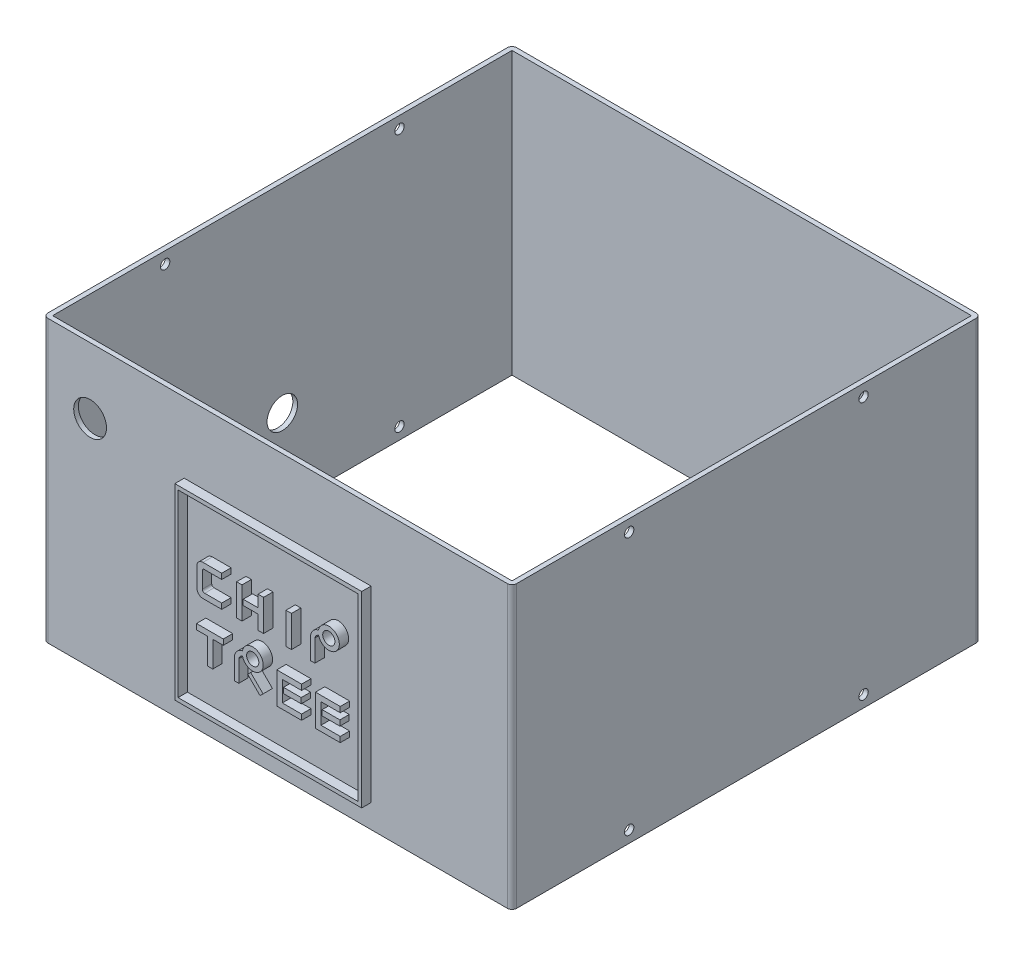
from build123d import *

# Parameters (mm, degrees)
SKETCH1_W                 = 100
SKETCH1_H                 = 100
BOSS_EXTRUDE1_DEPTH       = 60
SKETCH2_W                 = 98
SKETCH2_H                 = 98
CUT_EXTRUDE1_DEPTH        = 60
SKETCH3_R                 = 1
CUT_EXTRUDE2_DEPTH        = 125
CUT_EXTRUDE3_DEPTH        = 10
BOSS_EXTRUDE4_START       = 50
BOSS_EXTRUDE4_OUTLINE_W   = 39.858082606
BOSS_EXTRUDE4_OUTLINE_H   = 40
BOSS_EXTRUDE4_OUTLINE_W_2 = 38.374033315
BOSS_EXTRUDE4_OUTLINE_H_2 = 38.356376399
BOSS_EXTRUDE4_OUTLINE_W_3 = 1.151682465
BOSS_EXTRUDE4_OUTLINE_H_3 = 6.68708673
BOSS_EXTRUDE4_OUTLINE_W_4 = 1.169732075
BOSS_EXTRUDE4_OUTLINE_R   = 1.29952059
BOSS_EXTRUDE4_OUTLINE_W_5 = 3.781559684
BOSS_EXTRUDE4_OUTLINE_H_4 = 1.155970525
BOSS_EXTRUDE4_OUTLINE_W_6 = 3.781559683
BOSS_EXTRUDE4_DEPTH       = 2
SKETCH9_R                 = 3.5
CUT_EXTRUDE4_DEPTH        = 10
FILLET1_R                 = 1


# Read off the part's stored shape, not the designer's step: Boss-Extrude4
with BuildPart() as part:
    # Sketch1 → Boss-Extrude1 (new body)
    with BuildSketch(Plane(origin=(0, 0, 0), x_dir=(1, 0, 0), z_dir=(0, 1, 0))):
        Rectangle(SKETCH1_W, SKETCH1_H)
    extrude(amount=BOSS_EXTRUDE1_DEPTH)

    # Sketch2 → Cut-Extrude1 (cut)
    with BuildSketch(Plane(origin=(0, 60, 0), x_dir=(1, 0, 0), z_dir=(0, 1, 0))):
        Rectangle(SKETCH2_W, SKETCH2_H)
    extrude(amount=-CUT_EXTRUDE1_DEPTH, mode=Mode.SUBTRACT)

    # Sketch3 → Cut-Extrude2 (cut)
    with BuildSketch(Plane(origin=(50, 0, 0), x_dir=(0, 0, -1), z_dir=(1, 0, 0))):
        with BuildLine():
            ThreePointArc((-24, 57.5), (-25, 58.5), (-26, 57.5))
            Line((-26, 57.5), (-24, 57.5))
        make_face()
        with BuildLine():
            Line((-24, 57.5), (-26, 57.5))
            ThreePointArc((-26, 57.5), (-25, 56.5), (-24, 57.5))
        make_face()
        with Locations((25, 57.5)):
            Circle(SKETCH3_R)
        with Locations((-25, 2.5)):
            Circle(SKETCH3_R)
        with Locations((25, 2.5)):
            Circle(SKETCH3_R)
    extrude(amount=-CUT_EXTRUDE2_DEPTH, mode=Mode.SUBTRACT)

    # Sketch5 → Cut-Extrude3 (cut)
    with BuildSketch(Plane.ZY.offset(50)):
        with BuildLine():
            ThreePointArc((3.25, 17.5), (2.298097039, 19.798097039), (0, 20.75))
            Line((0, 20.75), (0, 14.25))
            ThreePointArc((0, 14.25), (2.298097039, 15.201902961), (3.25, 17.5))
        make_face()
        with BuildLine():
            Line((0, 14.25), (0, 20.75))
            ThreePointArc((0, 20.75), (-3.25, 17.5), (0, 14.25))
        make_face()
    extrude(amount=-CUT_EXTRUDE3_DEPTH, mode=Mode.SUBTRACT)

    # Boss-Extrude4 outline → Boss-Extrude4 (add)
    # profile 1 of 13: a face of its own
    with BuildSketch(Plane.XY.offset(BOSS_EXTRUDE4_START)):
        with Locations((0, 25)):
            Rectangle(BOSS_EXTRUDE4_OUTLINE_W, BOSS_EXTRUDE4_OUTLINE_H)
        with Locations((-0.051593215, 24.997020999)):
            Rectangle(BOSS_EXTRUDE4_OUTLINE_W_2, BOSS_EXTRUDE4_OUTLINE_H_2, mode=Mode.SUBTRACT)
    # profile 2 of 13: a face of its own
    with BuildSketch(Plane.XY.offset(BOSS_EXTRUDE4_START)):
        with BuildLine():
            Line((-9.922016309, 32.280172221), (-9.922016309, 33.453564236))
            Line((-9.922016309, 33.453564236), (-13.93029333, 33.453564236))
            ThreePointArc((-13.93029333, 33.453564236), (-14.849532145, 33.072803052), (-15.23029333, 32.153564236))
            Line((-15.23029333, 32.153564236), (-15.23029333, 28.064542243))
            ThreePointArc((-15.23029333, 28.064542243), (-14.849532146, 27.145303428), (-13.93029333, 26.764542243))
            Line((-13.93029333, 26.764542243), (-9.925370196, 26.764542243))
            Line((-9.925370196, 26.764542243), (-9.925370196, 27.933655334))
            Line((-9.925370196, 27.933655334), (-13.55690574, 27.933655334))
            ThreePointArc((-13.55690574, 27.933655334), (-13.910459131, 28.080101943), (-14.05690574, 28.433655334))
            Line((-14.05690574, 28.433655334), (-14.05690574, 31.880172221))
            ThreePointArc((-14.05690574, 31.880172221), (-13.939748452, 32.163014933), (-13.65690574, 32.280172221))
            Line((-13.65690574, 32.280172221), (-9.922016309, 32.280172221))
        make_face()
    # profile 3 of 13: a face of its own
    with BuildSketch(Plane.XY.offset(BOSS_EXTRUDE4_START)):
        with Locations((-6.175417948, 30.110020871)):
            Rectangle(BOSS_EXTRUDE4_OUTLINE_W_3, BOSS_EXTRUDE4_OUTLINE_H_3)
    # profile 4 of 13: a face of its own
    with BuildSketch(Plane.XY.offset(BOSS_EXTRUDE4_START)):
        Polygon((-1.00100917, 26.766477506), (-1.00100917, 33.453564236), (-2.170113717, 33.453564236), (-2.170113717, 30.935634342), (-5.349717596, 30.935634342), (-5.349717596, 29.768397912), (-2.170113717, 29.768397912), (-2.170113717, 26.766477506), align=None)
    # profile 5 of 13: a face of its own
    with BuildSketch(Plane.XY.offset(BOSS_EXTRUDE4_START)):
        with Locations((4.358014237, 30.110020871)):
            Rectangle(BOSS_EXTRUDE4_OUTLINE_W_4, BOSS_EXTRUDE4_OUTLINE_H_3)
    # profile 6 of 13: a face of its own
    with BuildSketch(Plane.XY.offset(BOSS_EXTRUDE4_START)):
        with BuildLine():
            Line((9.038474855, 26.766477506), (9.954821181, 26.766477506))
            Line((9.954821181, 26.766477506), (9.954821181, 31.435250737))
            ThreePointArc((9.954821181, 31.435250737), (10.237464032, 31.982611448), (10.746519943, 32.329530473))
            ThreePointArc((10.746519943, 32.329530473), (15.159384473, 32.918290446), (10.721414833, 33.271046936))
            ThreePointArc((10.721414833, 33.271046936), (9.619160753, 32.646851071), (9.038474855, 31.521067599))
            Line((9.038474855, 31.521067599), (9.038474855, 26.766477506))
        make_face()
        with Locations((12.921637239, 32.858621929)):
            Circle(BOSS_EXTRUDE4_OUTLINE_R, mode=Mode.SUBTRACT)
    # profile 7 of 13: a face of its own
    with BuildSketch(Plane.XY.offset(BOSS_EXTRUDE4_START)):
        Polygon((15.358270934, 20.30132248), (15.358270934, 21.474568974), (10.074546624, 21.474568974), (10.074546624, 14.78091915), (15.358270934, 14.78091915), (15.358270934, 15.94490899), (11.24592521, 15.94490899), (11.24592521, 20.30132248), align=None)
    # profile 8 of 13: a face of its own
    with BuildSketch(Plane.XY.offset(BOSS_EXTRUDE4_START)):
        Polygon((7.108297958, 21.474568974), (1.824573649, 21.474568974), (1.824573649, 14.78091915), (7.108297958, 14.78091915), (7.108297958, 15.94490899), (2.995952235, 15.94490899), (2.995952235, 20.30132248), (7.108297958, 20.30132248), align=None)
    # profile 9 of 13: a face of its own
    with BuildSketch(Plane.XY.offset(BOSS_EXTRUDE4_START)):
        with Locations((13.387987428, 18.375193575)):
            Rectangle(BOSS_EXTRUDE4_OUTLINE_W_5, BOSS_EXTRUDE4_OUTLINE_H_4)
    # profile 10 of 13: a face of its own
    with BuildSketch(Plane.XY.offset(BOSS_EXTRUDE4_START)):
        with Locations((5.138014453, 18.375193575)):
            Rectangle(BOSS_EXTRUDE4_OUTLINE_W_6, BOSS_EXTRUDE4_OUTLINE_H_4)
    # profile 11 of 13: a face of its own
    with BuildSketch(Plane.XY.offset(BOSS_EXTRUDE4_START)):
        with BuildLine():
            Line((-6.283421644, 14.927747144), (-6.283421644, 19.478331399))
            ThreePointArc((-6.283421644, 19.478331399), (-6.000778792, 20.025692111), (-5.491722882, 20.372611136))
            ThreePointArc((-5.491722882, 20.372611136), (-1.078858352, 20.961371104), (-5.516827991, 21.314127598))
            ThreePointArc((-5.516827991, 21.314127598), (-6.619082072, 20.689931733), (-7.19976797, 19.564148262))
            Line((-7.19976797, 19.564148262), (-7.19976797, 14.927747144))
            Line((-7.19976797, 14.927747144), (-6.283421644, 14.927747144))
        make_face()
        with Locations((-3.316605586, 20.901702592)):
            Circle(BOSS_EXTRUDE4_OUTLINE_R, mode=Mode.SUBTRACT)
    # profile 12 of 13: a face of its own
    with BuildSketch(Plane.XY.offset(BOSS_EXTRUDE4_START)):
        Polygon((-3.743380156, 18.2010008), (-4.392168827, 17.55221213), (-1.75326942, 14.913312723), (-1.104480749, 15.562101393), align=None)
    # profile 13 of 13: a face of its own
    with BuildSketch(Plane.XY.offset(BOSS_EXTRUDE4_START)):
        Polygon((-15.305624402, 21.469309136), (-15.305624402, 20.296062642), (-13.00828814, 20.296062642), (-13.00828814, 14.784735536), (-11.838556065, 14.784735536), (-11.838556065, 20.296062642), (-9.582967691, 20.296062642), (-9.582967691, 21.469309136), align=None)
    extrude(amount=BOSS_EXTRUDE4_DEPTH)

    # Sketch9 → Cut-Extrude4 (cut)
    with BuildSketch(Plane.XY.offset(50)):
        with Locations((-40, 46)):
            Circle(SKETCH9_R)
    extrude(amount=-CUT_EXTRUDE4_DEPTH, mode=Mode.SUBTRACT)

    # Fillet1
    fillet1_edges = [part.edges().sort_by_distance(p)[0] for p in [
        (50, 30, 50),
        (-50, 30, 50),
        (-50, 30, -50),
        (50, 30, -50),
    ]]
    fillet(fillet1_edges, radius=FILLET1_R)


solid = part.part
